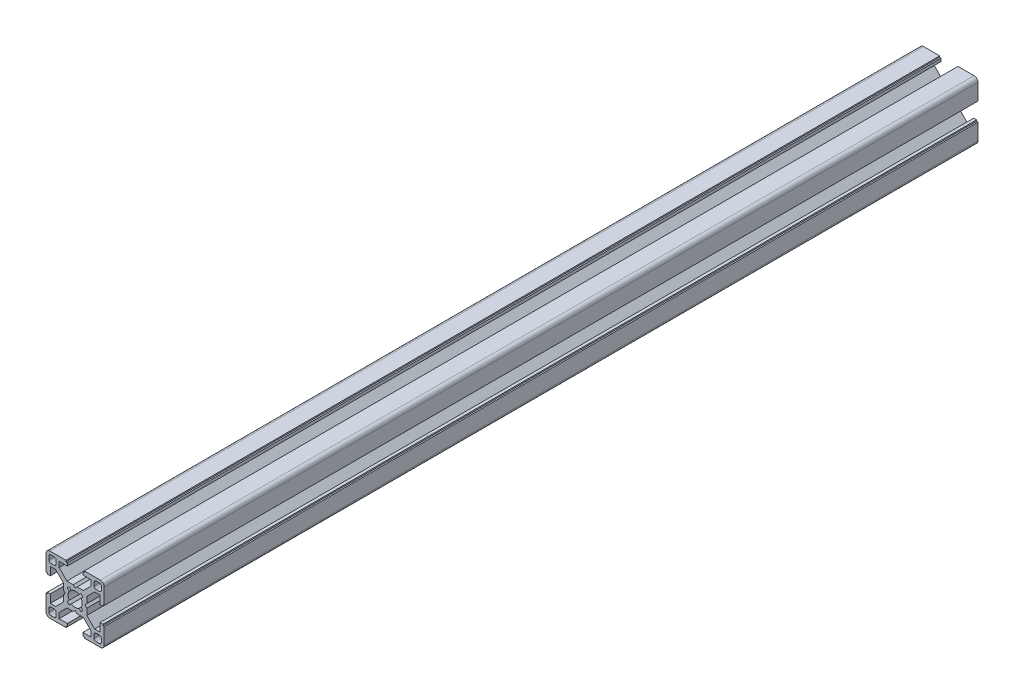
from build123d import *

# Parameters (mm, degrees)
ESTRUSIONE_ESTRUSIONE2_DEPTH = 450


with BuildPart() as part:
    # Schizzo1 → Estrusione-Estrusione2 (new body)
    with BuildSketch(Plane.XY):
        with BuildLine():
            ThreePointArc((-13, 15), (-14.414213562, 14.414213562), (-15, 13))
            Line((-15, 13), (-15, 4.7))
            Line((-15, 4.7), (-14.3, 4.7))
            Line((-14.3, 4.7), (-14.3, 4))
            Line((-14.3, 4), (-12.8, 4))
            Line((-12.8, 4), (-12.8, 8.25))
            Line((-12.8, 8.25), (-10.017766953, 8.25))
            Line((-10.017766953, 8.25), (-6, 4.232233047))
            Line((-6, 4.232233047), (-6, 1))
            Line((-6, 1), (-5, 0))
            Line((-5, 0), (-6, -1))
            Line((-6, -1), (-6, -4.232233047))
            Line((-6, -4.232233047), (-10.017766953, -8.25))
            Line((-10.017766953, -8.25), (-12.8, -8.25))
            Line((-12.8, -8.25), (-12.8, -4))
            Line((-12.8, -4), (-14.3, -4))
            Line((-14.3, -4), (-14.3, -4.7))
            Line((-14.3, -4.7), (-15, -4.7))
            Line((-15, -4.7), (-15, -13))
            ThreePointArc((-15, -13), (-14.414213562, -14.414213562), (-13, -15))
            Line((-13, -15), (-4.7, -15))
            Line((-4.7, -15), (-4.7, -14.3))
            Line((-4.7, -14.3), (-4, -14.3))
            Line((-4, -14.3), (-4, -12.8))
            Line((-4, -12.8), (-8.25, -12.8))
            Line((-8.25, -12.8), (-8.25, -10.017766953))
            Line((-8.25, -10.017766953), (-4.232233047, -6))
            Line((-4.232233047, -6), (-1, -6))
            Line((-1, -6), (0, -5))
            Line((0, -5), (1, -6))
            Line((1, -6), (4.232233047, -6))
            Line((4.232233047, -6), (8.25, -10.017766953))
            Line((8.25, -10.017766953), (8.25, -12.8))
            Line((8.25, -12.8), (4, -12.8))
            Line((4, -12.8), (4, -14.3))
            Line((4, -14.3), (4.7, -14.3))
            Line((4.7, -14.3), (4.7, -15))
            Line((4.7, -15), (13, -15))
            ThreePointArc((13, -15), (14.414213562, -14.414213562), (15, -13))
            Line((15, -13), (15, -4.7))
            Line((15, -4.7), (14.3, -4.7))
            Line((14.3, -4.7), (14.3, -4))
            Line((14.3, -4), (12.8, -4))
            Line((12.8, -4), (12.8, -8.25))
            Line((12.8, -8.25), (10.017766953, -8.25))
            Line((10.017766953, -8.25), (6, -4.232233047))
            Line((6, -4.232233047), (6, -1))
            Line((6, -1), (5, 0))
            Line((5, 0), (6, 1))
            Line((6, 1), (6, 4.232233047))
            Line((6, 4.232233047), (10.017766953, 8.25))
            Line((10.017766953, 8.25), (12.8, 8.25))
            Line((12.8, 8.25), (12.8, 4))
            Line((12.8, 4), (14.3, 4))
            Line((14.3, 4), (14.3, 4.7))
            Line((14.3, 4.7), (15, 4.7))
            Line((15, 4.7), (15, 13))
            ThreePointArc((15, 13), (14.414213562, 14.414213562), (13, 15))
            Line((13, 15), (4.7, 15))
            Line((4.7, 15), (4.7, 14.3))
            Line((4.7, 14.3), (4, 14.3))
            Line((4, 14.3), (4, 12.8))
            Line((4, 12.8), (8.25, 12.8))
            Line((8.25, 12.8), (8.25, 10.017766953))
            Line((8.25, 10.017766953), (4.232233047, 6))
            Line((4.232233047, 6), (1, 6))
            Line((1, 6), (0, 5))
            Line((0, 5), (-1, 6))
            Line((-1, 6), (-4.232233047, 6))
            Line((-4.232233047, 6), (-8.25, 10.017766953))
            Line((-8.25, 10.017766953), (-8.25, 12.8))
            Line((-8.25, 12.8), (-4, 12.8))
            Line((-4, 12.8), (-4, 14.3))
            Line((-4, 14.3), (-4.7, 14.3))
            Line((-4.7, 14.3), (-4.7, 15))
            Line((-4.7, 15), (-13, 15))
        make_face()
        with BuildLine():
            Line((-13.5, -12.5), (-13.5, -10.75))
            ThreePointArc((-13.5, -10.75), (-13.207106781, -10.042893219), (-12.5, -9.75))
            Line((-12.5, -9.75), (-10.75, -9.75))
            ThreePointArc((-10.75, -9.75), (-10.042893219, -10.042893219), (-9.75, -10.75))
            Line((-9.75, -10.75), (-9.75, -12.5))
            ThreePointArc((-9.75, -12.5), (-10.042893219, -13.207106781), (-10.75, -13.5))
            Line((-10.75, -13.5), (-12.5, -13.5))
            ThreePointArc((-12.5, -13.5), (-13.207106781, -13.207106781), (-13.5, -12.5))
        make_face(mode=Mode.SUBTRACT)
        with BuildLine():
            Line((12.5, -13.5), (10.75, -13.5))
            ThreePointArc((10.75, -13.5), (10.042893219, -13.207106781), (9.75, -12.5))
            Line((9.75, -12.5), (9.75, -10.75))
            ThreePointArc((9.75, -10.75), (10.042893219, -10.042893219), (10.75, -9.75))
            Line((10.75, -9.75), (12.5, -9.75))
            ThreePointArc((12.5, -9.75), (13.207106781, -10.042893219), (13.5, -10.75))
            Line((13.5, -10.75), (13.5, -12.5))
            ThreePointArc((13.5, -12.5), (13.207106781, -13.207106781), (12.5, -13.5))
        make_face(mode=Mode.SUBTRACT)
        with BuildLine():
            ThreePointArc((-9.75, 10.75), (-10.042893219, 10.042893219), (-10.75, 9.75))
            Line((-10.75, 9.75), (-12.5, 9.75))
            ThreePointArc((-12.5, 9.75), (-13.207106781, 10.042893219), (-13.5, 10.75))
            Line((-13.5, 10.75), (-13.5, 12.5))
            ThreePointArc((-13.5, 12.5), (-13.207106781, 13.207106781), (-12.5, 13.5))
            Line((-12.5, 13.5), (-10.75, 13.5))
            ThreePointArc((-10.75, 13.5), (-10.042893219, 13.207106781), (-9.75, 12.5))
            Line((-9.75, 12.5), (-9.75, 10.75))
        make_face(mode=Mode.SUBTRACT)
        with BuildLine():
            ThreePointArc((0, 3.65), (1.041005187, 3.498400806), (1.995536102, 3.056196274))
            Line((1.995536102, 3.056196274), (3.00520382, 4.065863992))
            Line((3.00520382, 4.065863992), (4.065863992, 3.00520382))
            Line((4.065863992, 3.00520382), (3.056196274, 1.995536102))
            ThreePointArc((3.056196274, 1.995536102), (3.498400806, 1.041005187), (3.65, 0))
            ThreePointArc((3.65, 0), (3.498400806, -1.041005187), (3.056196274, -1.995536102))
            Line((3.056196274, -1.995536102), (4.065863992, -3.00520382))
            Line((4.065863992, -3.00520382), (3.00520382, -4.065863992))
            Line((3.00520382, -4.065863992), (1.995536102, -3.056196274))
            ThreePointArc((1.995536102, -3.056196274), (1.041005187, -3.498400806), (0, -3.65))
            ThreePointArc((0, -3.65), (-1.041005187, -3.498400806), (-1.995536102, -3.056196274))
            Line((-1.995536102, -3.056196274), (-3.00520382, -4.065863992))
            Line((-3.00520382, -4.065863992), (-4.065863992, -3.00520382))
            Line((-4.065863992, -3.00520382), (-3.056196274, -1.995536102))
            ThreePointArc((-3.056196274, -1.995536102), (-3.498400806, -1.041005187), (-3.65, 0))
            ThreePointArc((-3.65, 0), (-3.498400806, 1.041005187), (-3.056196274, 1.995536102))
            Line((-3.056196274, 1.995536102), (-4.065863992, 3.00520382))
            Line((-4.065863992, 3.00520382), (-3.00520382, 4.065863992))
            Line((-3.00520382, 4.065863992), (-1.995536102, 3.056196274))
            ThreePointArc((-1.995536102, 3.056196274), (-1.041005187, 3.498400806), (0, 3.65))
        make_face(mode=Mode.SUBTRACT)
        with BuildLine():
            Line((13.5, 12.5), (13.5, 10.75))
            ThreePointArc((13.5, 10.75), (13.207106781, 10.042893219), (12.5, 9.75))
            Line((12.5, 9.75), (10.75, 9.75))
            ThreePointArc((10.75, 9.75), (10.042893219, 10.042893219), (9.75, 10.75))
            Line((9.75, 10.75), (9.75, 12.5))
            ThreePointArc((9.75, 12.5), (10.042893219, 13.207106781), (10.75, 13.5))
            Line((10.75, 13.5), (12.5, 13.5))
            ThreePointArc((12.5, 13.5), (13.207106781, 13.207106781), (13.5, 12.5))
        make_face(mode=Mode.SUBTRACT)
    extrude(amount=ESTRUSIONE_ESTRUSIONE2_DEPTH)


solid = part.part
